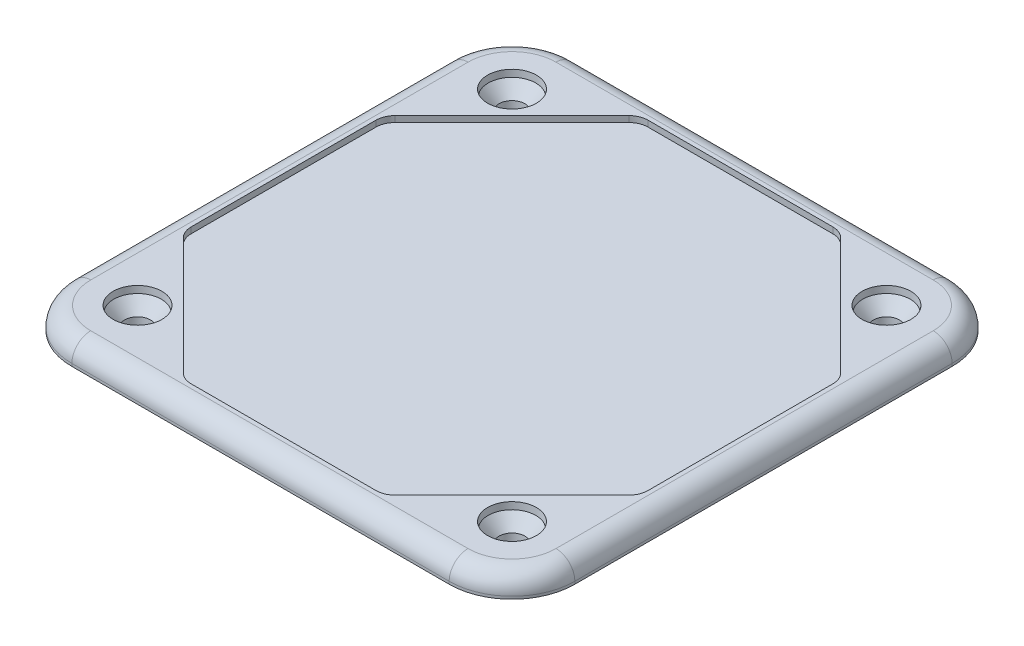
from build123d import *

# Parameters (mm, degrees)
SKETCH1_W           = 63.627
SKETCH1_H           = 63.627
BOSS_EXTRUDE1_DEPTH = 2.7178
CUT_EXTRUDE1_DEPTH  = 0.762
SKETCH3_W           = 58.293
SKETCH3_H           = 58.293
BOSS_EXTRUDE2_DEPTH = 1.6002
SKETCH4_W           = 55.0926
SKETCH4_H           = 55.0926
CUT_EXTRUDE2_DEPTH  = 1.6002
SKETCH5_W           = 3.175
SKETCH5_H           = 1.6002
SKETCH6_W           = 3.175
SKETCH6_H           = 1.6002
SKETCH7_W           = 3.175
SKETCH7_H           = 1.6002
SKETCH8_W           = 3.175
SKETCH8_H           = 1.6002
FILLET1_R           = 7.9502
FILLET2_R           = 2.3876
FILLET3_R           = 3.683
FILLET4_R           = 5.2832


with BuildPart() as part:
    # Sketch1 → Boss-Extrude1 (new body)
    with BuildSketch(Plane(origin=(0, 0, 0), x_dir=(1, 0, 0), z_dir=(0, 1, 0))):
        Rectangle(SKETCH1_W, SKETCH1_H)
    extrude(amount=-BOSS_EXTRUDE1_DEPTH)

    # Sketch2 → Cut-Extrude1 (cut)
    with BuildSketch(Plane(origin=(0, 0, 0), x_dir=(-1, 0, 0), z_dir=(0, 1, 0))):
        Polygon((12.685676302, -28.8925), (28.8925, -12.685676302), (28.8925, 12.685676302), (12.685676302, 28.8925), (-12.685676302, 28.8925), (-28.8925, 12.685676302), (-28.8925, -12.685676302), (-12.685676302, -28.8925), align=None)
    extrude(amount=-CUT_EXTRUDE1_DEPTH, mode=Mode.SUBTRACT)

    # Sketch3 → Boss-Extrude2 (add)
    with BuildSketch(Plane.XZ.offset(2.7178)):
        Rectangle(SKETCH3_W, SKETCH3_H)
    extrude(amount=BOSS_EXTRUDE2_DEPTH)

    # Sketch4 → Cut-Extrude2 (cut)
    with BuildSketch(Plane.XZ.offset(4.318)):
        Rectangle(SKETCH4_W, SKETCH4_H)
    extrude(amount=-CUT_EXTRUDE2_DEPTH, mode=Mode.SUBTRACT)

    # Sketch5 → Revolve1 (revolve)
    with BuildSketch(Plane(origin=(0, 0, -23.6855), x_dir=(-1, 0, 0), z_dir=(0, 0, -1))):
        with Locations((22.098, -3.5179)):
            Rectangle(SKETCH5_W, SKETCH5_H)
    revolve(axis=Axis((-23.6855, -4.318, -23.6855), (0, 1, 0)))

    # Sketch6 → Revolve2 (revolve)
    with BuildSketch(Plane(origin=(0, 0, 23.6855), x_dir=(-1, 0, 0), z_dir=(0, 0, -1))):
        with Locations((-25.273, -3.5179)):
            Rectangle(SKETCH6_W, SKETCH6_H)
    revolve(axis=Axis((23.6855, -4.318, 23.6855), (0, 1, 0)))

    # Sketch7 → Revolve3 (revolve)
    with BuildSketch(Plane(origin=(0, 0, 23.6855), x_dir=(-1, 0, 0), z_dir=(0, 0, -1))):
        with Locations((22.098, -3.5179)):
            Rectangle(SKETCH7_W, SKETCH7_H)
    revolve(axis=Axis((-23.6855, -4.318, 23.6855), (0, 1, 0)))

    # Sketch8 → Revolve4 (revolve)
    with BuildSketch(Plane(origin=(0, 0, -23.6855), x_dir=(-1, 0, 0), z_dir=(0, 0, -1))):
        with Locations((-25.273, -3.5179)):
            Rectangle(SKETCH8_W, SKETCH8_H)
    revolve(axis=Axis((23.6855, -4.318, -23.6855), (0, 1, 0)))

    # Sketch9 → Cut-Revolve1 (revolve, cut)
    with BuildSketch(Plane.XY.offset(-23.6855)):
        Polygon((-20.5994, 0), (-23.6855, 0), (-23.6855, -4.318), (-22.2123, -4.318), (-22.045796889, -2.414860733), (-20.672453944, -0.835010396), align=None)
    revolve(axis=Axis((-23.6855, 0, -23.6855), (0, -1, 0)), mode=Mode.SUBTRACT)

    # Sketch10 → Cut-Revolve2 (revolve, cut)
    with BuildSketch(Plane.XY.offset(23.6855)):
        Polygon((26.7716, 0), (23.6855, 0), (23.6855, -4.318), (25.1587, -4.318), (25.325203111, -2.414860733), (26.698546056, -0.835010396), align=None)
    revolve(axis=Axis((23.6855, 0, 23.6855), (0, -1, 0)), mode=Mode.SUBTRACT)

    # Sketch11 → Cut-Revolve3 (revolve, cut)
    with BuildSketch(Plane.XY.offset(23.6855)):
        Polygon((-20.5994, 0), (-23.6855, 0), (-23.6855, -4.318), (-22.2123, -4.318), (-22.045796889, -2.414860733), (-20.672453944, -0.835010396), align=None)
    revolve(axis=Axis((-23.6855, 0, 23.6855), (0, -1, 0)), mode=Mode.SUBTRACT)

    # Sketch12 → Cut-Revolve4 (revolve, cut)
    with BuildSketch(Plane.XY.offset(-23.6855)):
        Polygon((26.7716, 0), (23.6855, 0), (23.6855, -4.318), (25.1587, -4.318), (25.325203111, -2.414860733), (26.698546056, -0.835010396), align=None)
    revolve(axis=Axis((23.6855, 0, -23.6855), (0, -1, 0)), mode=Mode.SUBTRACT)

    # Fillet1
    fillet1_edges = [part.edges().sort_by_distance(p)[0] for p in [
        (31.8135, -1.3589, 31.8135),
        (-31.8135, -1.3589, -31.8135),
        (-31.8135, -1.3589, 31.8135),
        (31.8135, -1.3589, -31.8135),
    ]]
    fillet(fillet1_edges, radius=FILLET1_R)

    # Fillet2
    fillet2_edges = [part.edges().sort_by_distance(p)[0] for p in [
        (-12.685676302, -0.381, -28.8925),
        (29.484940332, 0, 29.484940332),
        (31.8135, 0, 0),
        (0, 0, 31.8135),
        (29.484940332, 0, -29.484940332),
        (-29.484940332, 0, 29.484940332),
        (0, 0, -31.8135),
        (-31.8135, 0, 0),
        (-29.484940332, 0, -29.484940332),
        (12.685676302, -0.381, 28.8925),
        (-12.685676302, -0.381, 28.8925),
        (-28.8925, -0.381, -12.685676302),
        (28.8925, -0.381, 12.685676302),
        (28.8925, -0.381, -12.685676302),
        (12.685676302, -0.381, -28.8925),
        (-28.8925, -0.381, 12.685676302),
    ]]
    fillet(fillet2_edges, radius=FILLET2_R)

    # Fillet3
    fillet3_edges = [part.edges().sort_by_distance(p)[0] for p in [
        (-27.5463, -3.5179, 27.5463),
        (27.5463, -3.5179, 27.5463),
        (-27.5463, -3.5179, -27.5463),
        (27.5463, -3.5179, -27.5463),
    ]]
    fillet(fillet3_edges, radius=FILLET3_R)

    # Fillet4
    fillet4_edges = [part.edges().sort_by_distance(p)[0] for p in [
        (29.1465, -3.5179, 29.1465),
        (29.1465, -3.5179, -29.1465),
        (-29.1465, -3.5179, -29.1465),
        (-29.1465, -3.5179, 29.1465),
    ]]
    fillet(fillet4_edges, radius=FILLET4_R)


solid = part.part
